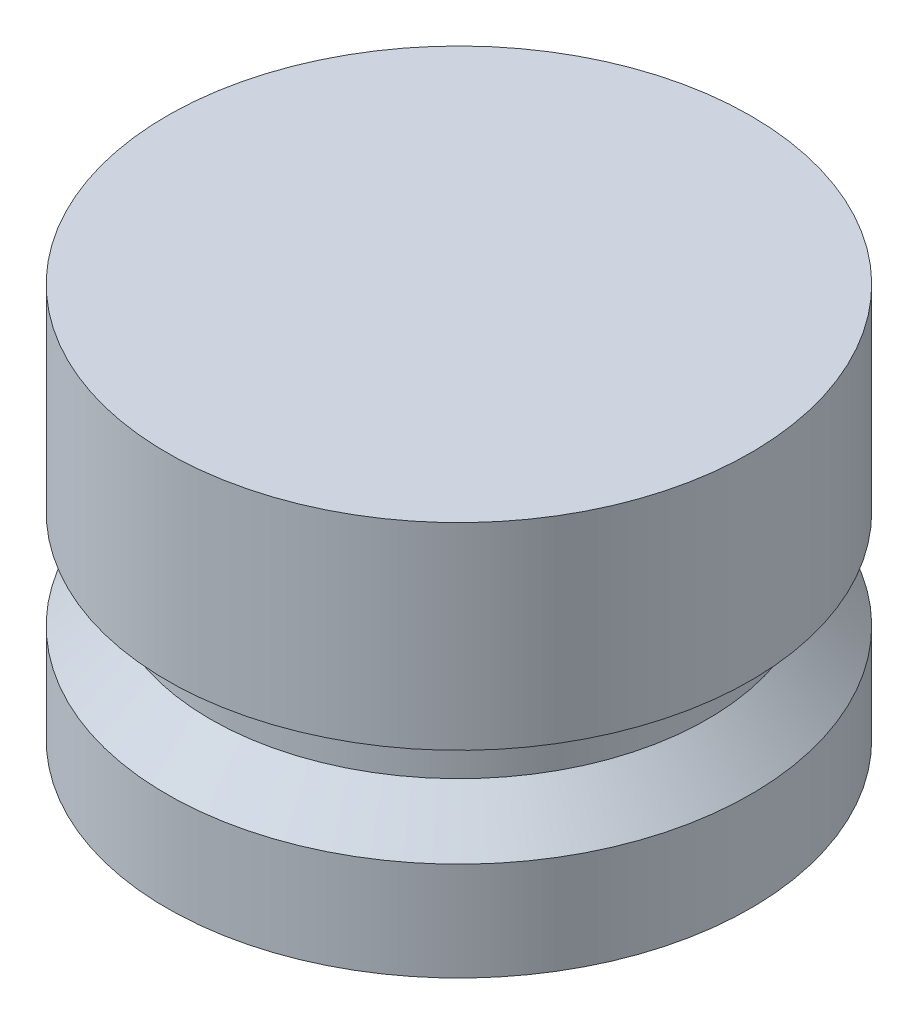
from build123d import *


with BuildPart() as part:
    # Sketch1 → Revolve1 (revolve)
    with BuildSketch(Plane.XY):
        Polygon((0, 0), (-9.398, 0), (-9.398, 3.175), (-8.001, 4.572), (-8.001, 6.35), (-9.398, 6.35), (-9.398, 12.7), (0, 12.7), align=None)
    revolve(axis=Axis((0, 0, 0), (0, 1, 0)))


solid = part.part
